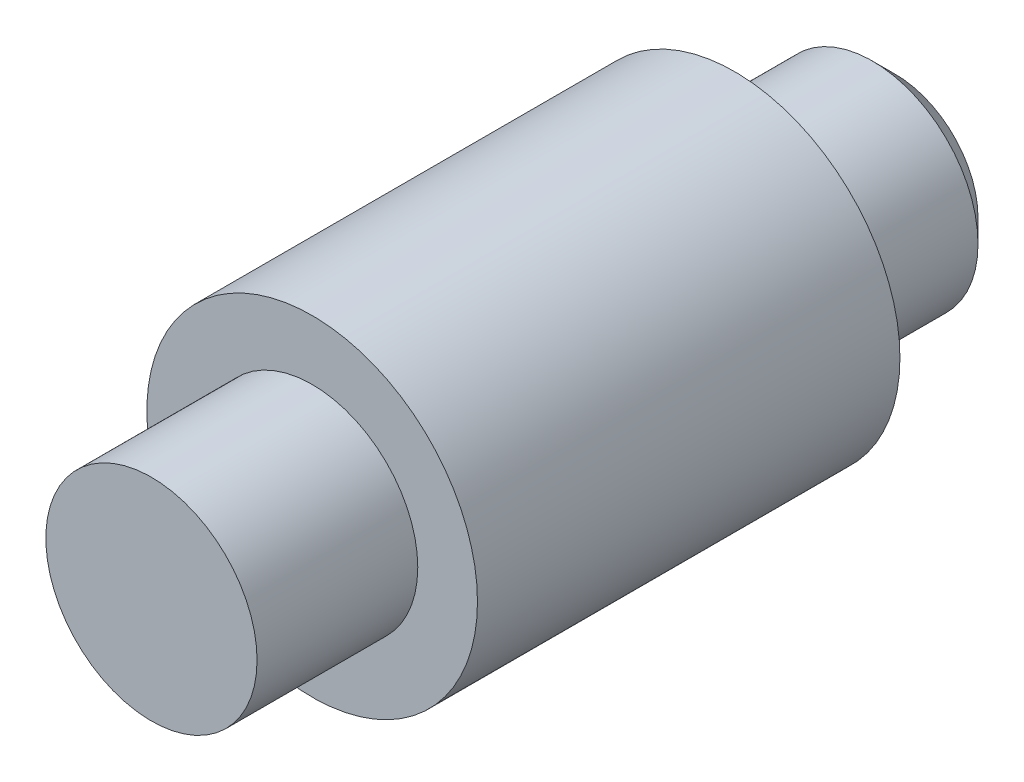
from build123d import *

# Parameters (mm, degrees)
SKETCH3_R           = 3.6
BOSS_EXTRUDE1_DEPTH = 9.2
SKETCH4_R           = 2.3
BOSS_EXTRUDE2_DEPTH = 3.5
BOSS_EXTRUDE3_START = 3.5
SKETCH5_R           = 2.3
BOSS_EXTRUDE3_DEPTH = 3.5
CHAMFER1_SIZE       = 0.5


with BuildPart() as part:
    # Sketch3 → Boss-Extrude1 (new body)
    with BuildSketch(Plane.XY):
        Circle(SKETCH3_R)
    extrude(amount=BOSS_EXTRUDE1_DEPTH)

    # Sketch4 → Boss-Extrude2 (add)
    with BuildSketch(Plane.XY):
        Circle(SKETCH4_R)
    extrude(amount=-BOSS_EXTRUDE2_DEPTH)

    # Sketch5 → Boss-Extrude3 (add)
    with BuildSketch(Plane.XY.offset(9.2).offset(BOSS_EXTRUDE3_START)):
        Circle(SKETCH5_R)
    extrude(amount=-BOSS_EXTRUDE3_DEPTH)

    # Chamfer1
    chamfer1_edges = [part.edges().sort_by_distance(p)[0] for p in [
        (-2.3, 0, -3.5),
    ]]
    chamfer(chamfer1_edges, length=CHAMFER1_SIZE)


solid = part.part
